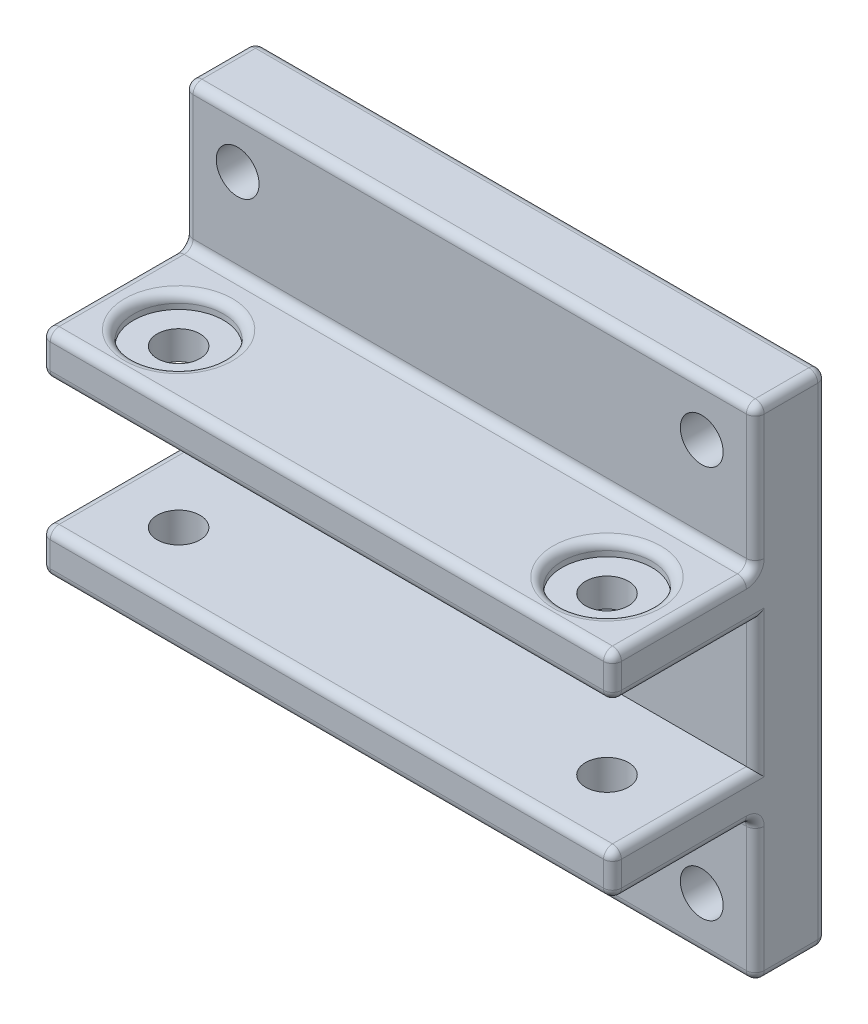
from build123d import *

# Parameters (mm, degrees)
SKETCH1_W               = 50.8
SKETCH1_H               = 44.45
BOSS_EXTRUDE1_DEPTH     = 6.35
SKETCH2_R               = 1.905
CUT_EXTRUDE1_DEPTH      = 6.35
SKETCH3_W               = 50.8
SKETCH3_H               = 3.81
BOSS_EXTRUDE2_DEPTH     = 12.7
SKETCH4_R               = 1.905
CUT_EXTRUDE2_DEPTH      = 63.861792847
SKETCH5_R               = 4.0005
CUT_EXTRUDE3_DEPTH      = 1.27
FILLET1_R               = 0.79375
SKETCH6_R               = 1.905
CUT_EXTRUDE4_DEPTH      = 5.08
MIRROR2_COPY_1_SKETCH_R = 1.905
MIRROR2_COPY_1_DEPTH    = 6.35
MIRROR2_COPY_2_SKETCH_R = 1.905
MIRROR2_COPY_2_DEPTH    = 5.08
MIRROR2_COPY_3_SKETCH_R = 1.905
MIRROR2_COPY_3_DEPTH    = 5.08


with BuildPart() as part:
    # Sketch1 → Boss-Extrude1 (new body)
    with BuildSketch(Plane.XY):
        with Locations((25.4, 22.225)):
            Rectangle(SKETCH1_W, SKETCH1_H)
    extrude(amount=BOSS_EXTRUDE1_DEPTH)

    # Sketch2 → Cut-Extrude1 (cut)
    with BuildSketch(Plane.XY.offset(6.35)):
        with Locations((4.7625, 39.6875)):
            Circle(SKETCH2_R)
    cut_extrude1 = extrude(amount=-CUT_EXTRUDE1_DEPTH, mode=Mode.SUBTRACT)

    # Sketch3 → Boss-Extrude2 (add)
    with BuildSketch(Plane.XY.offset(6.35)):
        with Locations((25.4, 29.845)):
            Rectangle(SKETCH3_W, SKETCH3_H)
        with Locations((25.4, 14.605)):
            Rectangle(SKETCH3_W, SKETCH3_H)
    extrude(amount=BOSS_EXTRUDE2_DEPTH)

    # Sketch4 → Cut-Extrude2 (cut, symmetric)
    with BuildSketch(Plane(origin=(0, 31.75, 0), x_dir=(1, 0, 0), z_dir=(0, 1, 0))):
        with Locations((6.35, -13.18895)):
            Circle(SKETCH4_R)
    cut_extrude2 = extrude(amount=CUT_EXTRUDE2_DEPTH, both=True, mode=Mode.SUBTRACT)

    # Mirror3: Cut-Extrude2 across plane
    add(cut_extrude2.mirror(Plane(origin=(25.4, 0, 0), x_dir=(0, 0, 1), z_dir=(1, 0, 0))), mode=Mode.SUBTRACT)

    # Sketch5 → Cut-Extrude3 (cut)
    with BuildSketch(Plane(origin=(0, 31.75, 0), x_dir=(1, 0, 0), z_dir=(0, 1, 0))):
        with Locations((6.35, -13.18895)):
            Circle(SKETCH5_R)
        with Locations((44.45, -13.18895)):
            Circle(SKETCH5_R)
    extrude(amount=-CUT_EXTRUDE3_DEPTH, mode=Mode.SUBTRACT)

    # Fillet1
    fillet1_edges = [part.edges().sort_by_distance(p)[0] for p in [
        (25.4, 0, 6.35),
        (25.4, 0, 0),
        (0, 38.1, 6.35),
        (0, 31.75, 12.7),
        (0, 27.94, 12.7),
        (0, 22.225, 6.35),
        (0, 16.51, 12.7),
        (0, 12.7, 12.7),
        (0, 6.35, 6.35),
        (0, 0, 3.175),
        (0, 22.225, 0),
        (25.4, 31.75, 19.05),
        (25.4, 27.94, 19.05),
        (0, 29.845, 19.05),
        (25.4, 16.51, 19.05),
        (25.4, 12.7, 19.05),
        (0, 14.605, 19.05),
        (50.8, 0, 3.175),
        (50.8, 6.35, 6.35),
        (50.8, 12.7, 12.7),
        (50.8, 14.605, 19.05),
        (50.8, 16.51, 12.7),
        (50.8, 22.225, 6.35),
        (50.8, 27.94, 12.7),
        (50.8, 29.845, 19.05),
        (50.8, 31.75, 12.7),
        (50.8, 38.1, 6.35),
        (50.8, 22.225, 0),
        (50.8, 44.45, 3.175),
        (25.4, 44.45, 6.35),
        (0, 44.45, 3.175),
        (25.4, 44.45, 0),
        (2.3495, 31.75, 13.18895),
        (40.4495, 31.75, 13.18895),
        (25.4, 12.7, 6.35),
        (25.4, 31.75, 6.35),
    ]]
    fillet(fillet1_edges, radius=FILLET1_R)

    # Sketch6 → Cut-Extrude4 (cut)
    with BuildSketch(Plane(origin=(0, 0, 0), x_dir=(-1, 0, 0), z_dir=(0, 0, -1))):
        with Locations((-44.45, 15.875)):
            Circle(SKETCH6_R)
    cut_extrude4 = extrude(amount=-CUT_EXTRUDE4_DEPTH, mode=Mode.SUBTRACT)

    # Mirror1: Cut-Extrude1, Cut-Extrude4 across plane
    add(cut_extrude1.mirror(Plane(origin=(25.4, 0, 0), x_dir=(0, 0, 1), z_dir=(1, 0, 0))), mode=Mode.SUBTRACT)
    add(cut_extrude4.mirror(Plane(origin=(25.4, 0, 0), x_dir=(0, 0, 1), z_dir=(1, 0, 0))), mode=Mode.SUBTRACT)

    # Mirror2: Cut-Extrude1 across plane
    add(cut_extrude1.mirror(Plane(origin=(0, 22.225, 0), x_dir=(0, 0, 1), z_dir=(0, -1, 0))), mode=Mode.SUBTRACT)

    # Mirror2 copy 1 sketch → Mirror2 copy 1 (cut)
    with BuildSketch(Plane(origin=(50.8, 44.45, 6.35), x_dir=(-1, 0, 0), z_dir=(0, 0, 1))):
        with Locations((4.7625, 39.6875)):
            Circle(MIRROR2_COPY_1_SKETCH_R)
    extrude(amount=-MIRROR2_COPY_1_DEPTH, mode=Mode.SUBTRACT)

    # Mirror2 copy 2 sketch → Mirror2 copy 2 (cut)
    with BuildSketch(Plane(origin=(50.8, 44.45, 0), x_dir=(1, 0, 0), z_dir=(0, 0, -1))):
        with Locations((-44.45, 15.875)):
            Circle(MIRROR2_COPY_2_SKETCH_R)
    extrude(amount=-MIRROR2_COPY_2_DEPTH, mode=Mode.SUBTRACT)

    # Mirror2 copy 3 sketch → Mirror2 copy 3 (cut)
    with BuildSketch(Plane(origin=(0, 44.45, 0), x_dir=(-1, 0, 0), z_dir=(0, 0, -1))):
        with Locations((-44.45, -15.875)):
            Circle(MIRROR2_COPY_3_SKETCH_R)
    extrude(amount=-MIRROR2_COPY_3_DEPTH, mode=Mode.SUBTRACT)


solid = part.part
